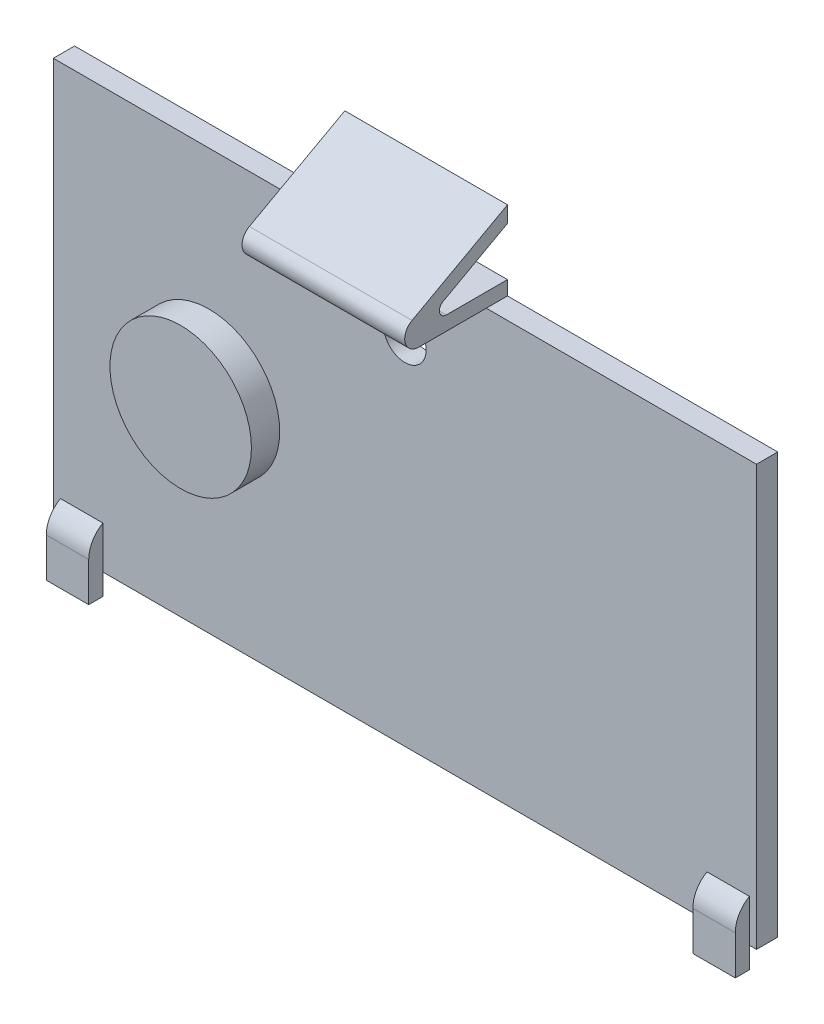
from build123d import *

# Parameters (mm, degrees)
CROQUIS1_W              = 49.7
CROQUIS1_H              = 29.7
SALIENTE_EXTRUIR1_DEPTH = 1.5
CROQUIS2_R              = 5
SALIENTE_EXTRUIR2_DEPTH = 2
CROQUIS3_W              = 3
CROQUIS3_H              = 3
SALIENTE_EXTRUIR3_DEPTH = 1
CROQUIS4_W              = 3
CROQUIS4_H              = 1
SALIENTE_EXTRUIR4_DEPTH = 1.5
REDONDEO1_R             = 2
SALIENTE_EXTRUIR5_DEPTH = 5.75
CROQUIS7_R              = 1.5
CORTAR_EXTRUIR1_DEPTH   = 11.5


with BuildPart() as part:
    # Croquis1 → Saliente-Extruir1 (new body)
    with BuildSketch(Plane.XY):
        with Locations((0, 14.85)):
            Rectangle(CROQUIS1_W, CROQUIS1_H)
    extrude(amount=SALIENTE_EXTRUIR1_DEPTH)

    # Croquis2 → Saliente-Extruir2 (add)
    with BuildSketch(Plane.XY.offset(1.5)):
        with Locations((-13.85, 14.85)):
            Circle(CROQUIS2_R)
    extrude(amount=SALIENTE_EXTRUIR2_DEPTH)

    # Croquis3 → Saliente-Extruir3 (add)
    with BuildSketch(Plane.XY.offset(1.5)):
        with Locations((-22.85, 1.5)):
            Rectangle(CROQUIS3_W, CROQUIS3_H)
        with Locations((22.85, 1.5)):
            Rectangle(CROQUIS3_W, CROQUIS3_H)
    extrude(amount=SALIENTE_EXTRUIR3_DEPTH)

    # Croquis4 → Saliente-Extruir4 (add)
    with BuildSketch(Plane.XZ):
        with Locations((-22.85, 2)):
            Rectangle(CROQUIS4_W, CROQUIS4_H)
        with Locations((22.85, 2)):
            Rectangle(CROQUIS4_W, CROQUIS4_H)
    extrude(amount=SALIENTE_EXTRUIR4_DEPTH)

    # Redondeo1
    # the kernel refuses this fillet: 2 mm, written as the material it takes off along each edge
    with BuildSketch(Plane(origin=(-17.019872981, 3, 2.5), x_dir=(0, -1, 0), z_dir=(-1, 0, 0)), Plane(origin=(28.680127019, 3, 2.5), x_dir=(0, -1, 0), z_dir=(-1, 0, 0))) as redondeo1_piece_1:
        with BuildLine():
            CenterArc((1.732050808, -2), REDONDEO1_R, 90, 60)
            Line((0, -1), (-0.034641016, -0.98))
            ThreePointArc((-0.034641016, -0.98), (-0.04, -0.5), (-0.04, 0))
            Line((-0.04, 0), (0, 0.04))
            Line((0, 0.04), (1.732050808, 0.04))
            Line((1.732050808, 0.04), (1.732050808, 0))
        make_face()
    extrude(amount=11.660254038, mode=Mode.SUBTRACT)

    # Croquis6 → Saliente-Extruir5 (add, symmetric)
    with BuildSketch(Plane(origin=(0, 0, 0), x_dir=(0, 0, -1), z_dir=(1, 0, 0))):
        with BuildLine():
            Line((0, 29.7), (-6.265388986, 29.7))
            ThreePointArc((-6.265388986, 29.7), (-7.234013908, 30.451472819), (-6.746848229, 31.57646848))
            Line((-6.746848229, 31.57646848), (0, 35.282628504))
            Line((0, 35.282628504), (0, 34.141686163))
            Line((0, 34.141686163), (-4.557388257, 31.63823424))
            ThreePointArc((-4.557388257, 31.63823424), (-4.800971096, 31.075736409), (-4.316658635, 30.7))
            Line((-4.316658635, 30.7), (0, 30.7))
            Line((0, 30.7), (0, 29.7))
        make_face()
    extrude(amount=SALIENTE_EXTRUIR5_DEPTH, both=True)

    # Croquis7 → Cortar-Extruir1 (cut)
    with BuildSketch(Plane(origin=(0, 0, 0), x_dir=(-1, 0, 0), z_dir=(0, 0, -1))):
        with Locations((0, 25)):
            Circle(CROQUIS7_R)
    extrude(amount=-CORTAR_EXTRUIR1_DEPTH, mode=Mode.SUBTRACT)


solid = part.part
